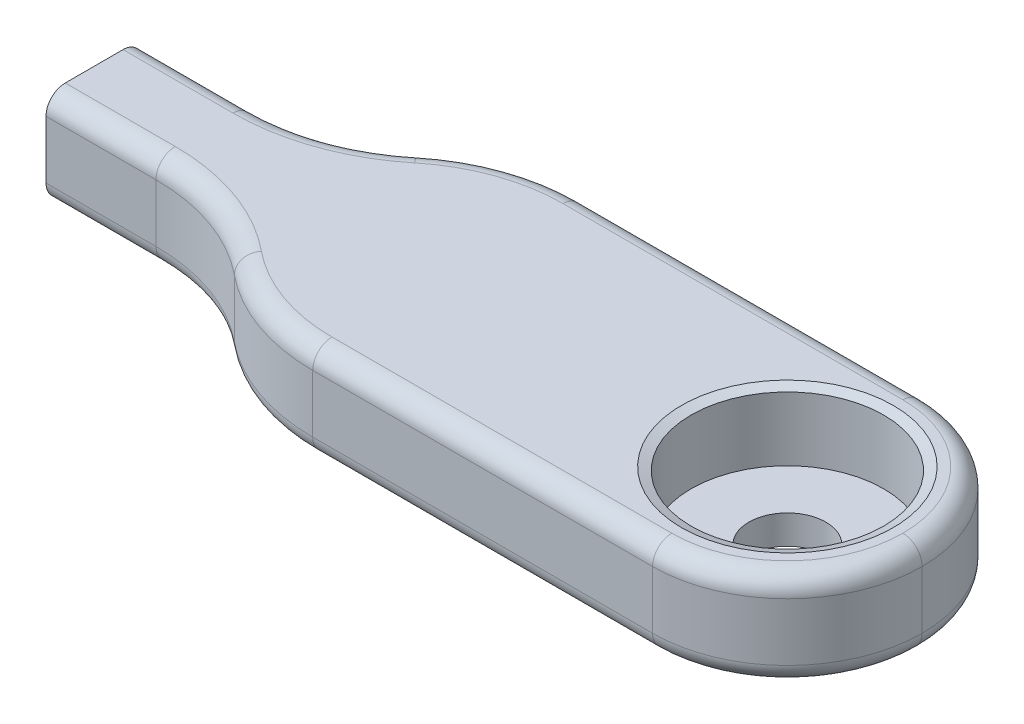
from build123d import *

# Parameters (mm, degrees)
SKETCH_2_W          = 43
SKETCH_2_H          = 14
EXTRUDE_1_DEPTH     = 5
SKETCH_6_R          = 5
CUT_EXTRUDE_4_DEPTH = 3.5
SKETCH_7_W          = 10
SKETCH_7_H          = 4.5
CUT_EXTRUDE_5_DEPTH = 10
FILLET_1_R          = 10
FILLET_2_R          = 10
FILLET_4_R          = 7
CHAMFER_1_SIZE      = 0.5
CHAMFER_1_SIZE2     = 0.181985117
FILLET_3_R          = 1
SKETCH_8_R          = 2.2
CUT_EXTRUDE_6_DEPTH = 3
FILLET_5_R          = 2
SKETCH_9_R          = 2
CUT_EXTRUDE_7_DEPTH = 4


# Some blends are built 0.0001 mm under size
with BuildPart() as part:
    # Эскиз2 → Бобышка-Вытянуть1 (new body)
    with BuildSketch(Plane(origin=(0, 0, 0), x_dir=(1, 0, 0), z_dir=(0, 1, 0))):
        Rectangle(SKETCH_2_W, SKETCH_2_H)
    extrude(amount=EXTRUDE_1_DEPTH)

    # Эскиз6 → Вырез-Вытянуть4 (cut)
    with BuildSketch(Plane(origin=(0, 5, 0), x_dir=(1, 0, 0), z_dir=(0, 1, 0))):
        with Locations(Location((14.5, 0, 0), (0, 0, 270))):
            Circle(SKETCH_6_R)
    extrude(amount=-CUT_EXTRUDE_4_DEPTH, mode=Mode.SUBTRACT)

    # Эскиз7 → Вырез-Вытянуть5 (cut)
    with BuildSketch(Plane(origin=(0, 5, 0), x_dir=(1, 0, 0), z_dir=(0, 1, 0))):
        with Locations((-16.5, -4.75)):
            Rectangle(SKETCH_7_W, SKETCH_7_H)
        with Locations((-16.5, 4.75)):
            Rectangle(SKETCH_7_W, SKETCH_7_H)
    extrude(amount=-CUT_EXTRUDE_5_DEPTH, mode=Mode.SUBTRACT)

    # Скругление1
    # the kernel refuses this fillet: 10 mm, written as the material it takes off along each edge
    with BuildSketch(Plane(origin=(-11.5, 25.879116361, 7), x_dir=(1, 0, 0), z_dir=(0, -1, 0))) as fillet_1_piece_1:
        with BuildLine():
            CenterArc((8.351646544, -10), FILLET_1_R, 90, 56.632987031)
            Line((0, -4.5), (-0.167032931, -4.39))
            ThreePointArc((-0.167032931, -4.39), (-0.2, -2.25), (-0.2, 0))
            Line((-0.2, 0), (0, 0.2))
            Line((0, 0.2), (8.351646544, 0.2))
            Line((8.351646544, 0.2), (8.351646544, 0))
        make_face()
    extrude(amount=46.758232721, mode=Mode.SUBTRACT)
    with BuildSketch(Plane(origin=(-11.5, 25.879116361, -7), x_dir=(1.535167055204576e-12, 0, 1.0), z_dir=(0, -1, 0))) as fillet_1_piece_2:
        with BuildLine():
            CenterArc((10, -8.351646544), FILLET_1_R, 123.367012969, 56.632987031)
            Line((0, -8.351646544), (-0.2, -8.351646544))
            Line((-0.2, -8.351646544), (-0.2, 0))
            Line((-0.2, 0), (0, 0.2))
            ThreePointArc((0, 0.2), (2.25, 0.2), (4.39, 0.167032931))
            Line((4.39, 0.167032931), (4.5, 0))
        make_face()
    extrude(amount=46.758232721, mode=Mode.SUBTRACT)

    # Скругление2
    fillet_2_edges = [part.edges().sort_by_distance(p)[0] for p in [
        (-11.5, 2.5, -2.5),
        (-11.5, 2.5, 2.5),
    ]]
    fillet(fillet_2_edges, radius=FILLET_2_R)

    # Скругление4
    fillet_4_edges = [part.edges().sort_by_distance(p)[0] for p in [
        (21.5, 2.5, -7),
        (21.5, 2.5, 7),
    ]]
    fillet(fillet_4_edges, radius=FILLET_4_R - 0.0001)  # a hair under: the kernel refuses the full size

    # Фаска1
    chamfer_1_edges = [part.edges().sort_by_distance(p)[0] for p in [
        (14.5, 5, -5),
    ]]
    chamfer_1_side = [part.faces().sort_by_distance(p)[0] for p in [
        (0.230514486, 5, 0),
    ]]
    chamfer(chamfer_1_edges, length=CHAMFER_1_SIZE, length2=CHAMFER_1_SIZE2, reference=chamfer_1_side[0])

    # Скругление3
    fillet_3_edges = [part.edges().sort_by_distance(p)[0] for p in [
        (-18.643789058, 0, 2.5),
        (-18.643789058, 5, -2.5),
        (5.675873272, 5, 7),
        (-6.502455422, 5, -6.420721841),
        (5.675873272, 0, 7),
        (-6.502455422, 0, 6.420721841),
        (-6.502455422, 0, -6.420721841),
        (-18.643789058, 0, -2.5),
        (-18.643789058, 5, 2.5),
        (-6.502455422, 5, 6.420721841),
        (-12.433476149, 5, -3.079278159),
        (-12.433476149, 0, -3.079278159),
        (-12.433476149, 5, 3.079278159),
        (-12.433476149, 0, 3.079278159),
        (5.675873272, 0, -7),
        (5.675873272, 5, -7),
        (19.449776758, 0, 4.949776758),
        (19.449776758, 0, -4.949776758),
        (19.449776758, 5, 4.949776758),
        (19.449776758, 5, -4.949776758),
    ]]
    fillet(fillet_3_edges, radius=FILLET_3_R)

    # Эскиз8 → Вырез-Вытянуть6 (cut)
    with BuildSketch(Plane.ZY.offset(21.5)):
        with Locations((0, 2.5)):
            Circle(SKETCH_8_R)
    extrude(amount=-CUT_EXTRUDE_6_DEPTH, mode=Mode.SUBTRACT)

    # Скругление5
    fillet_5_edges = [part.edges().sort_by_distance(p)[0] for p in [
        (-18.5, 2.5, -2.2),
    ]]
    fillet(fillet_5_edges, radius=FILLET_5_R)

    # Эскиз9 → Вырез-Вытянуть7 (cut)
    with BuildSketch(Plane(origin=(0, 1.5, 0), x_dir=(1, 0, 0), z_dir=(0, 1, 0))):
        with Locations(Location((14.5, 0, 0), (0, 0, 270))):
            Circle(SKETCH_9_R)
    extrude(amount=-CUT_EXTRUDE_7_DEPTH, mode=Mode.SUBTRACT)


solid = part.part
